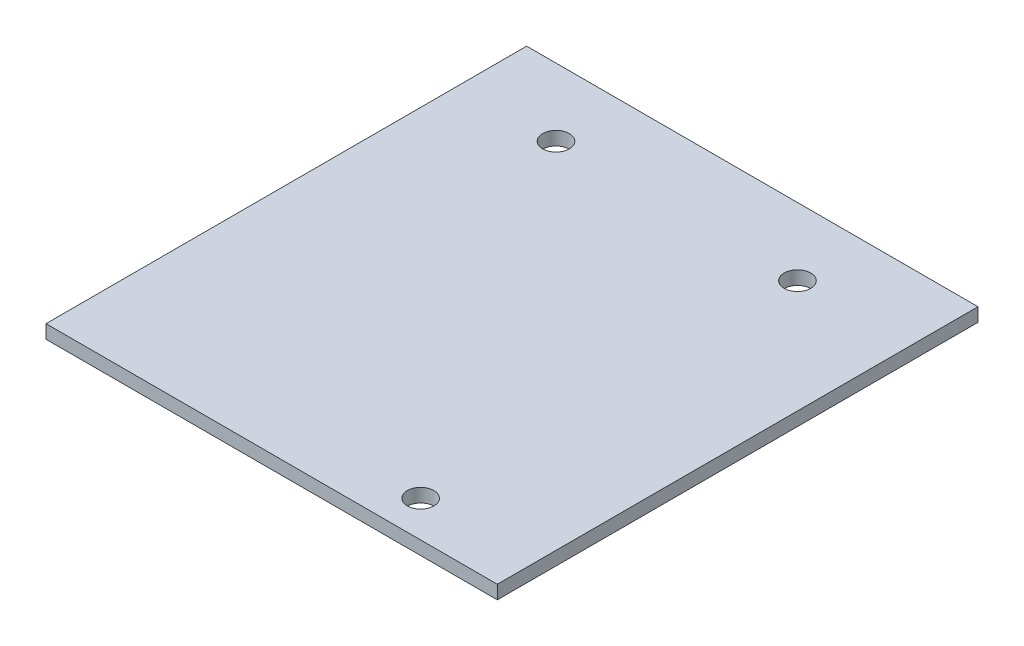
from build123d import *

# Parameters (mm, degrees)
SKETCH1_W           = 50.8
SKETCH1_H           = 54.102
BOSS_EXTRUDE1_DEPTH = 1.524
SKETCH2_R           = 1.4986
CUT_EXTRUDE1_DEPTH  = 1.524


with BuildPart() as part:
    # Sketch1 → Boss-Extrude1 (new body)
    with BuildSketch(Plane(origin=(0, 0, 0), x_dir=(1, 0, 0), z_dir=(0, 1, 0))):
        Rectangle(SKETCH1_W, SKETCH1_H)
    extrude(amount=BOSS_EXTRUDE1_DEPTH)

    # Sketch2 → Cut-Extrude1 (cut)
    with BuildSketch(Plane(origin=(0, 1.524, 0), x_dir=(1, 0, 0), z_dir=(0, 1, 0))):
        with Locations((-14.478, 19.431)):
            Circle(SKETCH2_R)
        with Locations((12.7, 19.431)):
            Circle(SKETCH2_R)
        with Locations((12.7, -22.987)):
            Circle(SKETCH2_R)
    extrude(amount=-CUT_EXTRUDE1_DEPTH, mode=Mode.SUBTRACT)


solid = part.part
